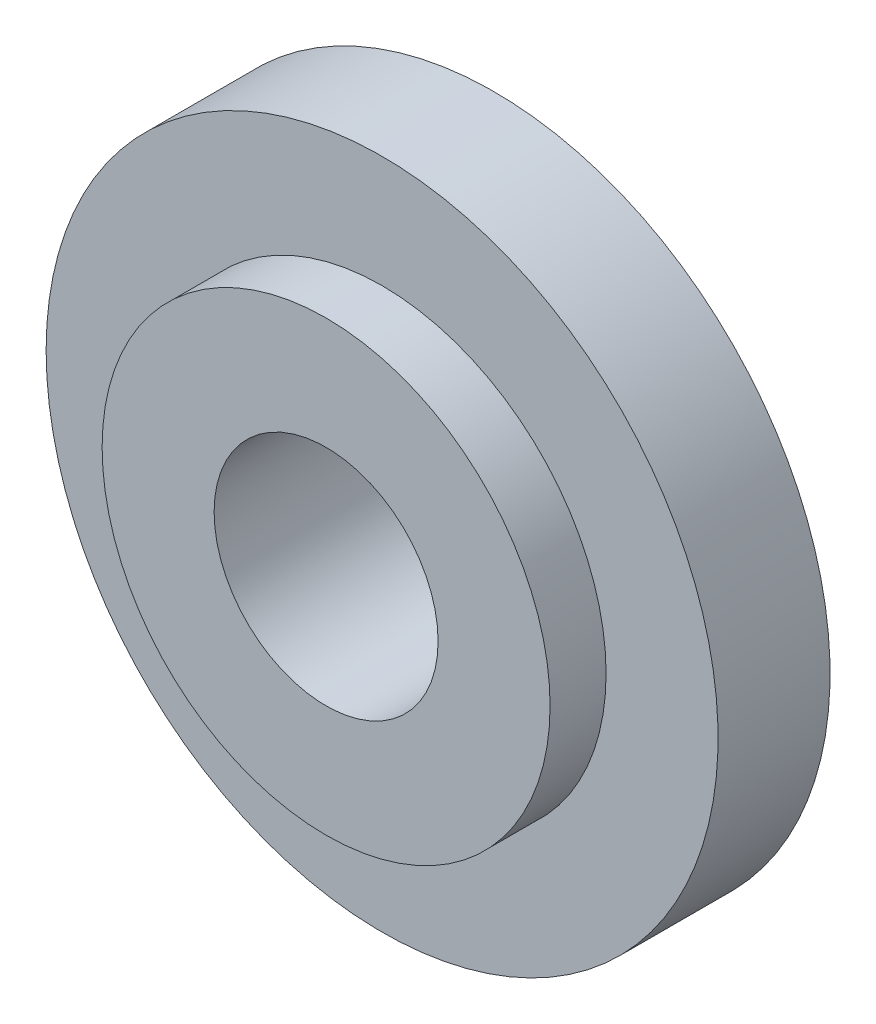
from build123d import *

# Parameters (mm, degrees)
SKETCH_1_R               = 4
EXTRUDE_1_DEPTH          = 3
SKETCH_3_R               = 6
EXTRUDE_2_DEPTH          = 2
CUT_EXTRUDE_1_DEPTH      = 10
CUT_EXTRUDE_1_DEPTH_BACK = 10
SKETCH_4_R               = 2


with BuildPart() as part:
    # Эскиз1 → Бобышка-Вытянуть1 (new body)
    with BuildSketch(Plane.XY):
        Circle(SKETCH_1_R)
    extrude(amount=EXTRUDE_1_DEPTH)

    # Эскиз3 → Бобышка-Вытянуть2 (add)
    with BuildSketch(Plane(origin=(0, 0, 0), x_dir=(-1, 0, 0), z_dir=(0, 0, -1))):
        Circle(SKETCH_3_R)
    extrude(amount=-EXTRUDE_2_DEPTH)

    # Эскиз4 → Вырез-Вытянуть1 (cut, two sides: drawn at the far end of the back side and taken through both)
    with BuildSketch(Plane.XY.offset(3).offset(-CUT_EXTRUDE_1_DEPTH_BACK)):
        Circle(SKETCH_4_R)
    extrude(amount=CUT_EXTRUDE_1_DEPTH + CUT_EXTRUDE_1_DEPTH_BACK, mode=Mode.SUBTRACT)


solid = part.part
